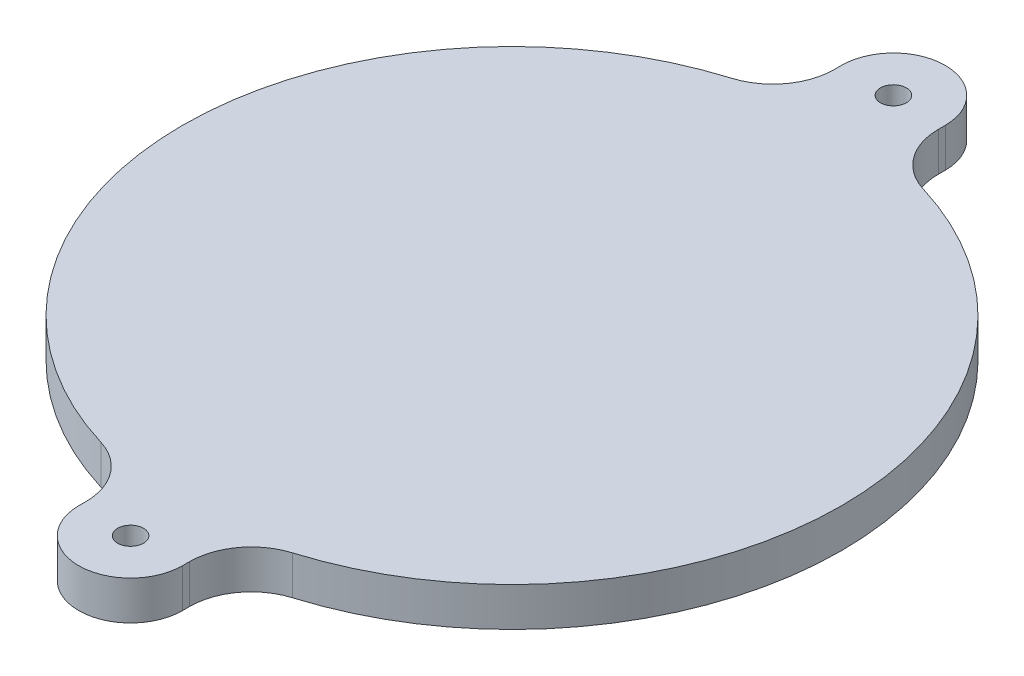
from build123d import *

# Parameters (mm, degrees)
SKETCH1_R           = 1
BOSS_EXTRUDE1_DEPTH = 3
FILLET1_R           = 4.7625


with BuildPart() as part:
    # Sketch1 → Boss-Extrude1 (new body)
    with BuildSketch(Plane.XZ.offset(0.396875)):
        with BuildLine():
            Line((-4, 29.4), (-4, 25.083062014))
            ThreePointArc((-4, 25.083062014), (-25.4, 0), (-4, -25.083062014))
            Line((-4, -25.083062014), (-4, -29.4))
            ThreePointArc((-4, -29.4), (0, -33.4), (4, -29.4))
            Line((4, -29.4), (4, -25.083062014))
            ThreePointArc((4, -25.083062014), (25.4, 0), (4, 25.083062014))
            Line((4, 25.083062014), (4, 29.4))
            ThreePointArc((4, 29.4), (0, 33.4), (-4, 29.4))
        make_face()
        with Locations((0, 29.4)):
            Circle(SKETCH1_R, mode=Mode.SUBTRACT)
        with Locations((0, -29.4)):
            Circle(SKETCH1_R, mode=Mode.SUBTRACT)
    extrude(amount=BOSS_EXTRUDE1_DEPTH)

    # Fillet1
    fillet1_edges = [part.edges().sort_by_distance(p)[0] for p in [
        (-4, -1.896875, -25.083062014),
        (4, -1.896875, -25.083062014),
        (4, -1.896875, 25.083062014),
        (-4, -1.896875, 25.083062014),
    ]]
    fillet(fillet1_edges, radius=FILLET1_R)


solid = part.part
